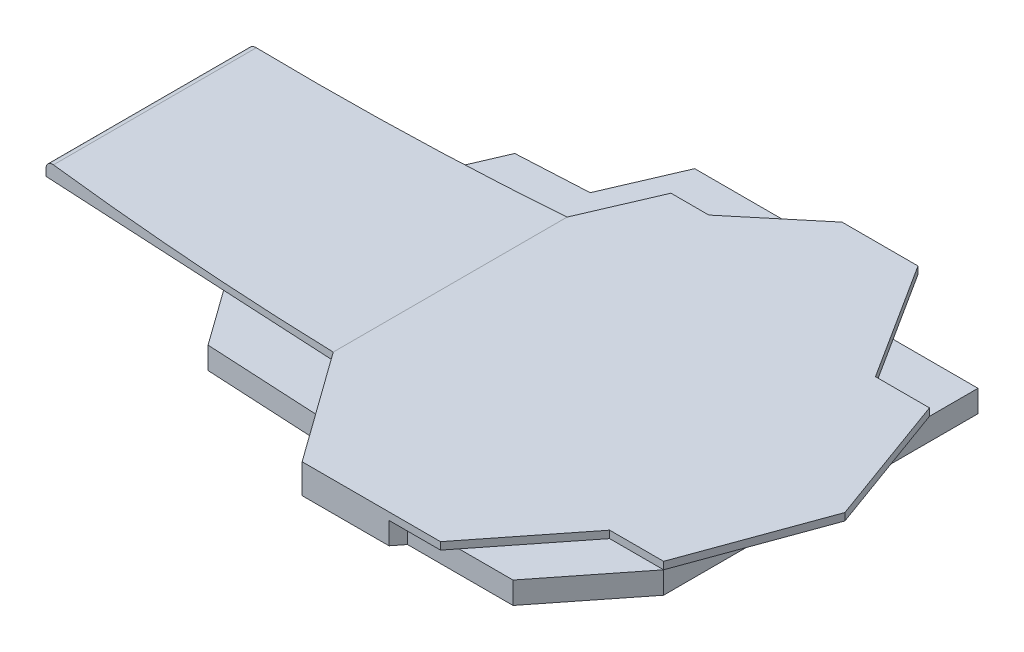
from build123d import *

# Parameters (mm, degrees)
EXTRUDE_1_DEPTH          = 2
EXTRUDE_2_DEPTH          = 2
CUT_EXTRUDE_3_DEPTH      = 202.869395429
CUT_EXTRUDE_3_DEPTH_BACK = 202.869395429
FILLET_1_R               = 2
EXTRUDE_4_DEPTH          = 6


with BuildPart() as part:
    # 草图2 → 凸台-拉伸1 (new body)
    with BuildSketch(Plane(origin=(0, 0, 0), x_dir=(1, 0, 0), z_dir=(0, 1, 0))):
        Polygon((141.821582241, 68.082690978), (121.161879345, 68.082690978), (101.35099463, 51.608897425), (91.039832206, 51.608897425), (82.527346571, 31.825074964), (0, 27.5), (0, -27.5), (82.527346571, -31.825074964), (104.14664553, -61.917309022), (141.821582241, -61.917309022), (162.133732132, -36.18552755), (176.829545061, -36.18552755), (190, 0), (176.829545061, 36.18552755), (162.133732132, 36.18552755), align=None)
    extrude(amount=EXTRUDE_1_DEPTH)

    # 草图6 → 凸台-拉伸2 (add)
    with BuildSketch(Plane(origin=(0, 2, 0), x_dir=(1, 0, 0), z_dir=(0, 1, 0))):
        Polygon((82.527346571, 31.825074964), (82.527346571, -31.825074964), (0, -27.5), (0, 27.5), align=None)
    extrude(amount=EXTRUDE_2_DEPTH)

    # 草图7 → 切除-拉伸3 (cut, two sides: drawn at the far end of the back side and taken through both)
    with BuildSketch(Plane.XY.offset(-CUT_EXTRUDE_3_DEPTH_BACK)):
        with BuildLine():
            Line((82.527346571, 2), (82.527346571, 30.740821148))
            Line((82.527346571, 30.740821148), (0, 4))
            add(Edge.make_bspline(
                [(82.527346571, 2), (41.215261335, 1.001172546), (0, 4)],
                knots=[0, 0, 0, 1, 1, 1], degree=2))
        make_face()
    extrude(amount=CUT_EXTRUDE_3_DEPTH + CUT_EXTRUDE_3_DEPTH_BACK, mode=Mode.SUBTRACT)

    # 圆角1
    fillet_1_edges = [part.edges().sort_by_distance(p)[0] for p in [
        (0, 4, 13.75),
    ]]
    fillet(fillet_1_edges, radius=FILLET_1_R)

    # 草图13 → 凸台-拉伸4 (add)
    with BuildSketch(Plane.XZ):
        Polygon((53.501507434, -30.303895193), (58.412275987, -41.716986195), (77.926898746, -42.739704237), (86.484415452, -62.62818317), (136.164724768, -62.62818317), (144.584081331, -49.40685536), (176.829545061, -49.40685536), (176.829545061, -36.18552755), (176.829545061, 36.18552755), (158.743204348, 59.097615602), (130.016377906, 59.097615602), (127.790568727, 61.917309022), (104.14664553, 61.917309022), (93.336996051, 46.871191993), (61.845926158, 45.220814953), (51.036276678, 30.174697924), (171.852914921, 31.825074964), (171.852914921, -31.825074964), align=None)
    extrude(amount=EXTRUDE_4_DEPTH)


solid = part.part
